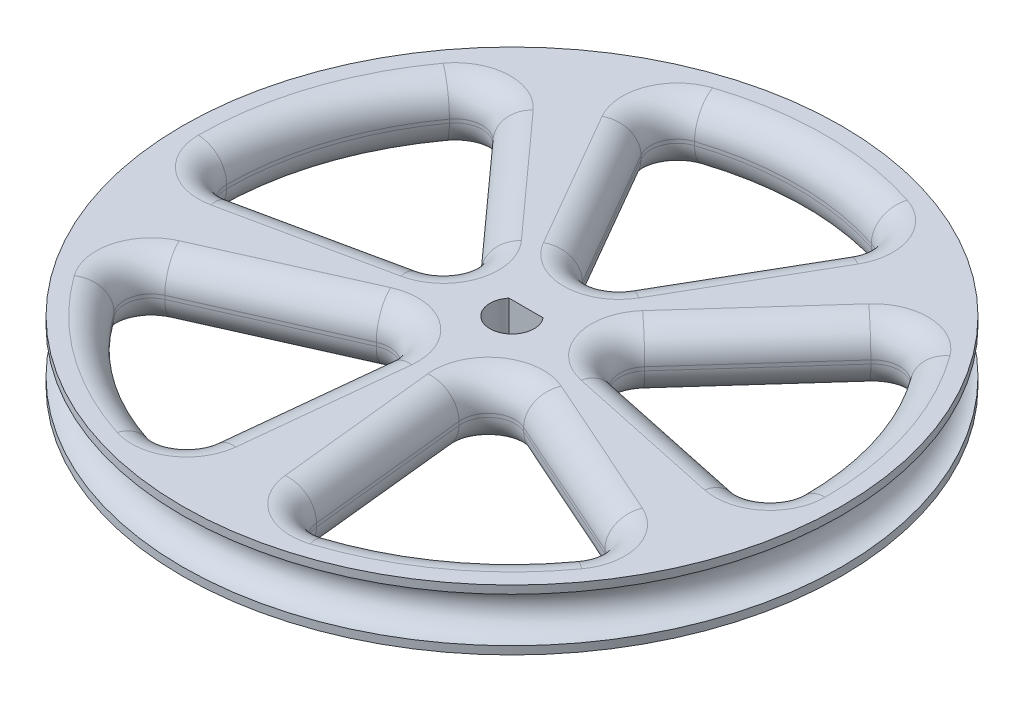
from build123d import *

# Parameters (mm, degrees)
SKETCH1_R                = 23.495
BOSS_EXTRUDE1_DEPTH      = 4.318
CUT_EXTRUDE1_DEPTH       = 34.50634528
CUT_EXTRUDE2_DEPTH       = 34.50634528
FILLET1_R                = 2.032
CIRPATTERN1_COUNT        = 5
FILLET1_OF_CIRPATTERN1_R = 2.032


# Read off the part's stored shape, not the designer's step: Cut-Revolve1
with BuildPart() as part:
    # Sketch1 → Boss-Extrude1 (new body)
    with BuildSketch(Plane(origin=(0, 0, 0), x_dir=(1, 0, 0), z_dir=(0, 1, 0))):
        with Locations(Location((0, 0, 0), (0, 0, 270))):
            Circle(SKETCH1_R)
    extrude(amount=BOSS_EXTRUDE1_DEPTH)

    # Sketch2 → Cut-Extrude1 (cut, through all)
    with BuildSketch(Plane(origin=(0, 4.318, 0), x_dir=(1, 0, 0), z_dir=(0, 1, 0))):
        with BuildLine():
            Line((-1.216809358, 1.000000032), (1.216809358, 1.000000032))
            ThreePointArc((1.216809358, 1.000000032), (0, -1.575000025), (-1.216809358, 1.000000032))
        make_face()
    extrude(amount=-CUT_EXTRUDE1_DEPTH, mode=Mode.SUBTRACT)

    # Sketch3 → Cut-Extrude2 (cut, through all)
    with BuildSketch(Plane(origin=(0, 4.318, 0), x_dir=(1, 0, 0), z_dir=(0, 1, 0))):
        with BuildLine():
            Line((-1.649778394, 6.6675), (-7.358497315, 16.555291217))
            ThreePointArc((-7.358497315, 16.555291217), (-7.487543609, 18.189559306), (-6.29927605, 19.318942032))
            ThreePointArc((-6.29927605, 19.318942032), (0, 20.32), (6.29927605, 19.318942032))
            ThreePointArc((6.29927605, 19.318942032), (7.487543609, 18.189559306), (7.358497315, 16.555291217))
            Line((7.358497315, 16.555291217), (1.649778394, 6.6675))
            ThreePointArc((1.649778394, 6.6675), (0, 5.715), (-1.649778394, 6.6675))
        make_face()
    cut_extrude2 = extrude(amount=-CUT_EXTRUDE2_DEPTH, mode=Mode.SUBTRACT)

    # Fillet1
    fillet1_edges = [part.edges().sort_by_distance(p)[0] for p in [
        (0, 0, -5.715),
        (-4.504137855, 0, -11.611395608),
        (-7.487543609, 0, -18.189559306),
        (0, 0, -20.32),
        (7.487543609, 0, -18.189559306),
        (4.504137855, 0, -11.611395608),
        (0, 4.318, -5.715),
        (4.504137855, 4.318, -11.611395608),
        (7.487543609, 4.318, -18.189559306),
        (0, 4.318, -20.32),
        (-7.487543609, 4.318, -18.189559306),
        (-4.504137855, 4.318, -11.611395608),
    ]]
    fillet(fillet1_edges, radius=FILLET1_R)

    # CirPattern1: Cut-Extrude2 ×5 about axis
    cirpattern1_axis = Axis((0, 0, 0), (0, 1, 0))
    for i in range(1, CIRPATTERN1_COUNT):
        add(cut_extrude2.rotate(cirpattern1_axis, i * 360 / CIRPATTERN1_COUNT), mode=Mode.SUBTRACT)

    # Fillet1 of CirPattern1
    fillet1_of_cirpattern1_edges = [part.edges().sort_by_distance(p)[0] for p in [
        (-5.435287991, 0, -1.766032123),
        (-12.434948599, 0, 0.695571085),
        (-19.613077128, 0, 1.500194195),
        (-19.325468411, 0, -6.279225326),
        (-14.985520685, 0, -12.741960086),
        (-9.651238315, 0, -7.871808228),
        (-5.435287991, 4.318, -1.766032123),
        (-9.651238315, 4.318, -7.871808228),
        (-14.985520685, 4.318, -12.741960086),
        (-19.325468411, 4.318, -6.279225326),
        (-19.613077128, 4.318, 1.500194195),
        (-12.434948599, 4.318, 0.695571085),
        (-3.359192717, 0, 4.623532123),
        (-3.181083028, 0, 12.041282181),
        (-4.63400468, 0, 19.116730308),
        (-11.943796327, 0, 16.439225326),
        (-16.749104732, 0, 10.314594889),
        (-10.468931166, 0, 6.74635057),
        (-3.359192717, 4.318, 4.623532123),
        (-10.468931166, 4.318, 6.74635057),
        (-16.749104732, 4.318, 10.314594889),
        (-11.943796327, 4.318, 16.439225326),
        (-4.63400468, 4.318, 19.116730308),
        (-3.181083028, 4.318, 12.041282181),
        (3.359192717, 0, 4.623532123),
        (10.468931166, 0, 6.74635057),
        (16.749104732, 0, 10.314594889),
        (11.943796327, 0, 16.439225326),
        (4.63400468, 0, 19.116730308),
        (3.181083028, 0, 12.041282181),
        (3.359192717, 4.318, 4.623532123),
        (3.181083028, 4.318, 12.041282181),
        (4.63400468, 4.318, 19.116730308),
        (11.943796327, 4.318, 16.439225326),
        (16.749104732, 4.318, 10.314594889),
        (10.468931166, 4.318, 6.74635057),
        (5.435287991, 0, -1.766032123),
        (9.651238315, 0, -7.871808228),
        (14.985520685, 0, -12.741960086),
        (19.325468411, 0, -6.279225326),
        (19.613077128, 0, 1.500194195),
        (12.434948599, 0, 0.695571085),
        (5.435287991, 4.318, -1.766032123),
        (12.434948599, 4.318, 0.695571085),
        (19.613077128, 4.318, 1.500194195),
        (19.325468411, 4.318, -6.279225326),
        (14.985520685, 4.318, -12.741960086),
        (9.651238315, 4.318, -7.871808228),
    ]]
    fillet(fillet1_of_cirpattern1_edges, radius=FILLET1_OF_CIRPATTERN1_R)

    # Cut-Revolve1 outline → Cut-Revolve1 (revolve, cut)
    with BuildSketch(Plane.XY):
        with BuildLine():
            ThreePointArc((23.495, 3.7465), (21.9075, 2.159), (23.495, 0.5715))
            Line((23.495, 0.5715), (23.495, 3.7465))
        make_face()
    revolve(axis=Axis((0, 0, 0), (0, 1, 0)), mode=Mode.SUBTRACT)


solid = part.part
